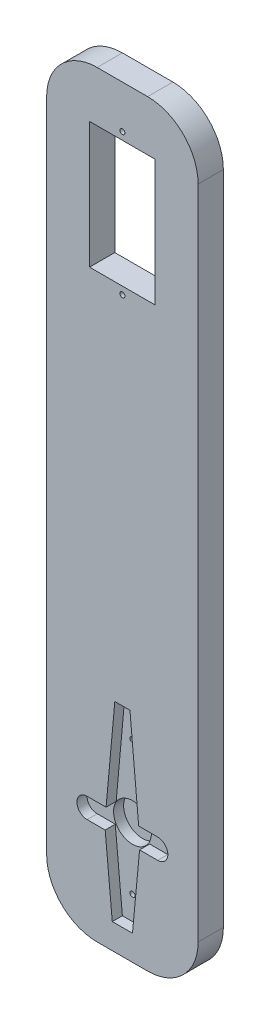
from build123d import *

# Parameters (mm, degrees)
SKICA1_W                 = 30
SKICA1_H                 = 150
P_IDAT_VYSUNUT_M1_DEPTH  = 5
ZAOBLIT1_R               = 10
SKICA2_W                 = 13
SKICA2_H                 = 25
ODEBRAT_VYSUNUT_M1_DEPTH = 154.05227865
SKICA3_R                 = 0.5
ODEBRAT_VYSUNUT_M2_DEPTH = 154.05227865
ODEBRAT_VYSUNUT_M3_DEPTH = 2
SKICA5_R                 = 0.5
ODEBRAT_VYSUNUT_M4_DEPTH = 154
SKICA6_R                 = 3.75
ODEBRAT_VYSUNUT_M5_DEPTH = 2


with BuildPart() as part:
    # Skica1 → Přidat vysunutím1 (new body)
    with BuildSketch(Plane.XY):
        with Locations((15, 75)):
            Rectangle(SKICA1_W, SKICA1_H)
    extrude(amount=P_IDAT_VYSUNUT_M1_DEPTH)

    # Zaoblit1
    zaoblit1_edges = [part.edges().sort_by_distance(p)[0] for p in [
        (30, 0, 2.5),
        (0, 0, 2.5),
        (30, 150, 2.5),
        (0, 150, 2.5),
    ]]
    fillet(zaoblit1_edges, radius=ZAOBLIT1_R)

    # Skica2 → Odebrat vysunutím1 (cut, through all)
    with BuildSketch(Plane.XY.offset(5)):
        with Locations((15, 127.5)):
            Rectangle(SKICA2_W, SKICA2_H)
    extrude(amount=-ODEBRAT_VYSUNUT_M1_DEPTH, mode=Mode.SUBTRACT)

    # Skica3 → Odebrat vysunutím2 (cut, through all)
    with BuildSketch(Plane.XY.offset(5)):
        with Locations((15, 141.5)):
            Circle(SKICA3_R)
        with Locations((15, 113.5)):
            Circle(SKICA3_R)
    extrude(amount=-ODEBRAT_VYSUNUT_M2_DEPTH, mode=Mode.SUBTRACT)

    # Skica4 → Odebrat vysunutím3 (cut)
    with BuildSketch(Plane.XY.offset(5)):
        with BuildLine():
            Line((8, 20), (11.59375, 20))
            Line((11.59375, 20), (13, 5))
            Line((13, 5), (17, 5))
            Line((17, 5), (18.40625, 20))
            Line((18.40625, 20), (22, 20))
            ThreePointArc((22, 20), (24, 22), (22, 24))
            Line((22, 24), (18.227272727, 24))
            Line((18.227272727, 24), (16.5, 43))
            Line((16.5, 43), (13.5, 43))
            Line((13.5, 43), (11.772727273, 24))
            Line((11.772727273, 24), (8, 24))
            ThreePointArc((8, 24), (6, 22), (8, 20))
        make_face()
    extrude(amount=-ODEBRAT_VYSUNUT_M3_DEPTH, mode=Mode.SUBTRACT)

    # Skica5 → Odebrat vysunutím4 (cut, through all)
    with BuildSketch(Plane.XY.offset(3)):
        with Locations((15, 36.2)):
            Circle(SKICA5_R)
        with Locations((15, 9.7)):
            Circle(SKICA5_R)
    extrude(amount=-ODEBRAT_VYSUNUT_M4_DEPTH, mode=Mode.SUBTRACT)

    # Skica6 → Odebrat vysunutím5 (cut)
    with BuildSketch(Plane.XY.offset(3)):
        with Locations((15, 22)):
            Circle(SKICA6_R)
    extrude(amount=-ODEBRAT_VYSUNUT_M5_DEPTH, mode=Mode.SUBTRACT)


solid = part.part
